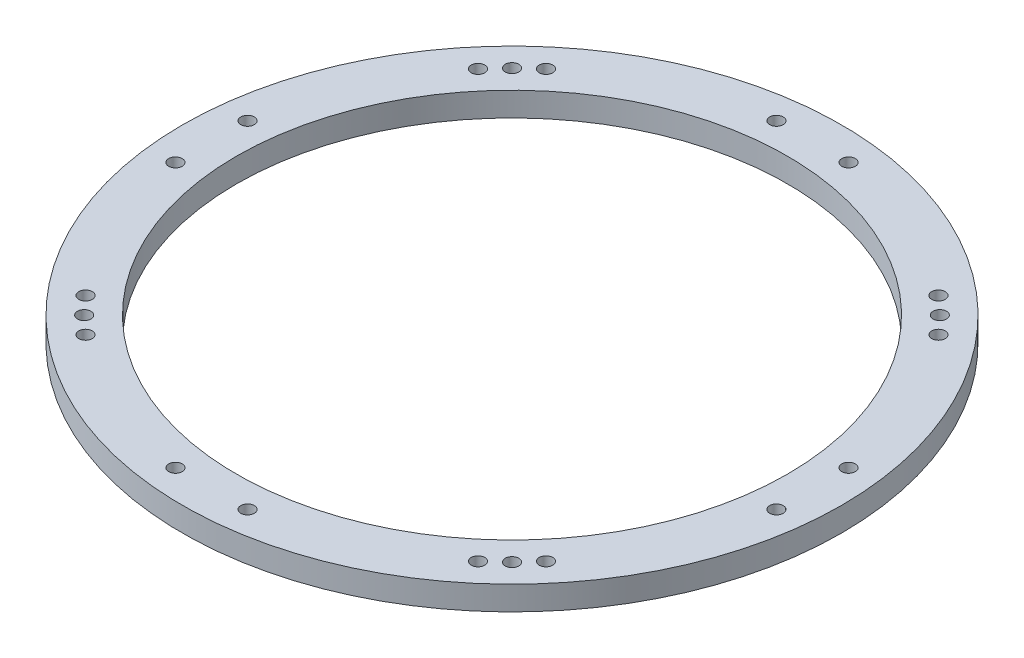
from build123d import *

# Parameters (mm, degrees)
SKETCH1_W                       = 28.575
SKETCH1_H                       = 12.7
F_9_32_0_28125_DIAMETER_HOLE1_D = 7.14375
SKETCH7_R                       = 3.571875
CUT_EXTRUDE1_DEPTH              = 247.543645639
CIRPATTERN1_COUNT               = 4


with BuildPart() as part:
    # Sketch1 → Revolve1 (revolve)
    with BuildSketch(Plane.XY):
        with Locations((159.813733777, 201.018503093)):
            Rectangle(SKETCH1_W, SKETCH1_H)
    revolve(axis=Axis((1e-09, -200000, 0), (0, 1, 0)))

    # 9/32 (0.28125) Diameter Hole1 (through all)
    with Locations(Plane(origin=(0, 207.368503093, 0), x_dir=(1, 0, 0), z_dir=(0, 1, 0))):
        with Locations((-113.00537488, 113.00537488), (-103.667734326, 121.628246568), (-121.628246568, 103.667734326)):
            f_9_32_0_28125_diameter_hole1 = Hole(F_9_32_0_28125_DIAMETER_HOLE1_D / 2)

    # Sketch7 → Cut-Extrude1 (cut, through all)
    with BuildSketch(Plane(origin=(0, 207.368503093, 0), x_dir=(1, 0, 0), z_dir=(0, 1, 0))):
        with Locations((158.75, -19.05)):
            Circle(SKETCH7_R)
        with Locations((158.75, 19.05)):
            Circle(SKETCH7_R)
    cut_extrude1 = extrude(amount=-CUT_EXTRUDE1_DEPTH, mode=Mode.SUBTRACT)

    # CirPattern1: 9/32 (0.28125) Diameter Hole1, Cut-Extrude1 ×4 about axis
    cirpattern1_axis = Axis((1e-09, -200000, 0), (0, -1, 0))
    add([f_9_32_0_28125_diameter_hole1.rotate(cirpattern1_axis, i * 360 / CIRPATTERN1_COUNT) for i in range(1, CIRPATTERN1_COUNT)], mode=Mode.SUBTRACT)
    add([cut_extrude1.rotate(cirpattern1_axis, i * 360 / CIRPATTERN1_COUNT) for i in range(1, CIRPATTERN1_COUNT)], mode=Mode.SUBTRACT)


solid = part.part
